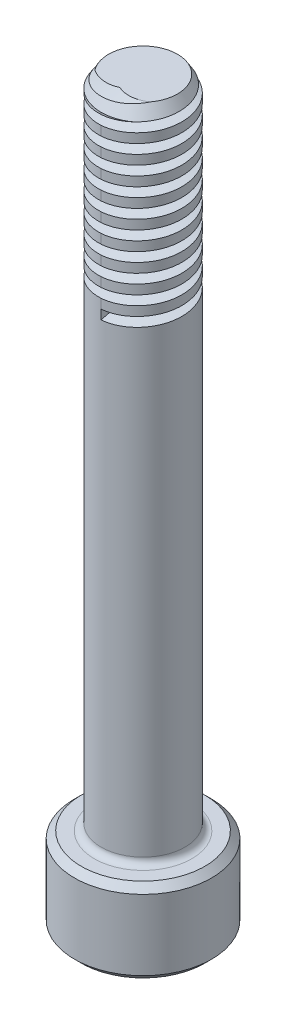
from build123d import *

# Parameters (mm, degrees)
CUT_SWEEP1_PITCH   = 0.635
CUT_EXTRUDE1_DEPTH = 1.2954
FILLET1_R          = 0.2286
FILLET2_R          = 0.396875794
CHAMFER2_SIZE      = 0.2286
CHAMFER3_SIZE      = 0.127


with BuildPart() as part:
    # Sketch1 → Revolve1 (revolve)
    with BuildSketch(Plane.XY, mode=Mode.PRIVATE) as revolve1_sk:
        Polygon((0, 0), (0, 25.0698), (1.4224, 25.0698), (1.4224, 2.8448), (2.3241, 2.8448), (2.3241, 0), align=None)
    revolve(revolve1_sk.sketch.rotate(Axis((0, 0, 0), (0, 1, 0)), 90), axis=Axis((0, 0, 0), (0, 1, 0)))

    # Cut-Sweep1: arcs per turn and ends read off the stored shape
    # Cut-Sweep1: the profile of Sketch3 profile screwed along a right-hand helix through 11 turns, 6 arcs to a turn; built about Z, then put on its axis
    cut_sweep1_z = Axis((0, 0, 0), (0, 0, 1))
    cut_sweep1_corners = [(1.4227, 0, -0.476175), (1.4227, 0, -0.793825), (0.78739873, 0, -0.635)]
    with BuildLine(mode=Mode.PRIVATE) as cut_sweep1_profile:
        Line(cut_sweep1_corners[0], cut_sweep1_corners[1])
        Line(cut_sweep1_corners[1], cut_sweep1_corners[2])
        Line(cut_sweep1_corners[2], cut_sweep1_corners[0])
    cut_sweep1_cap = Face(cut_sweep1_profile.wire())
    cut_sweep1_turn_angles = [0, 30, 60, 90, 120, 150, 180, 210, 240, 270, 300, 330, 360]
    cut_sweep1_turn_weights = [1, 0.8660254037844387, 1, 0.8660254037844387, 1, 0.8660254037844387, 1, 0.8660254037844387, 1, 0.8660254037844387, 1, 0.8660254037844387, 1]
    cut_sweep1_turn_rails = [Edge.make_bspline([Vector(p[0], p[1], 0).rotate(cut_sweep1_z, cut_sweep1_turn_angles[k]) / cut_sweep1_turn_weights[k] + Vector(0, 0, p[2] + CUT_SWEEP1_PITCH * cut_sweep1_turn_angles[k] / 360) for k in range(13)], [0, 0, 0, 1, 1, 2, 2, 3, 3, 4, 4, 5, 5, 6, 6, 6], 2, cut_sweep1_turn_weights) for p in cut_sweep1_corners]
    cut_sweep1_turn_sides = [Face.make_surface_from_curves(cut_sweep1_turn_rails[p[0]], cut_sweep1_turn_rails[p[1]]) for p in [(0, 1), (1, 2), (2, 0)]]
    cut_sweep1 = Plane(origin=(0, 25.0698, 0), x_dir=(0, 0, 1), z_dir=(0, -1, 0)) * Solid(Shell([*[p.moved(Location((0, 0, CUT_SWEEP1_PITCH * i))) for i in range(11) for p in cut_sweep1_turn_sides], cut_sweep1_cap, cut_sweep1_cap.rotate(cut_sweep1_z, 3960).moved(Location((0, 0, CUT_SWEEP1_PITCH * 3960 / 360)))]))
    add(cut_sweep1, mode=Mode.SUBTRACT)

    # Sketch4 → Cut-Extrude1 (cut)
    with BuildSketch(Plane(origin=(0, 0, 0), x_dir=(1, 0, 0), z_dir=(0, 1, 0))):
        Polygon((0, 1.378481503), (-1.1938, 0.689240751), (-1.1938, -0.689240751), (0, -1.378481503), (1.1938, -0.689240751), (1.1938, 0.689240751), align=None)
    extrude(amount=CUT_EXTRUDE1_DEPTH, mode=Mode.SUBTRACT)

    # Fillet1
    fillet1_edges = [part.edges().sort_by_distance(p)[0] for p in [
        (0, 2.8448, 1.4224),
    ]]
    fillet(fillet1_edges, radius=FILLET1_R)

    # Fillet2
    fillet2_edges = [part.edges().sort_by_distance(p)[0] for p in [
        (1.1938, 0.6477, -0.689240751),
        (0, 0.6477, -1.378481503),
        (-1.1938, 0.6477, -0.689240751),
        (-1.1938, 0.6477, 0.689240751),
        (0, 0.6477, 1.378481503),
        (1.1938, 0.6477, 0.689240751),
        (0.5969, 1.2954, -1.033861127),
        (-0.5969, 1.2954, -1.033861127),
        (-1.1938, 1.2954, 0),
        (-0.5969, 1.2954, 1.033861127),
        (0.5969, 1.2954, 1.033861127),
        (1.1938, 1.2954, 0),
    ]]
    fillet(fillet2_edges, radius=FILLET2_R)

    # Chamfer1: read off the stored shape, not the designer's step
    # Chamfer1 outline → Chamfer1 (revolve, cut)
    with BuildSketch(Plane.XY):
        Polygon((1.4224, 25.0698), (1.168399492, 25.0698), (1.4224, 24.658376279), align=None)
    revolve(axis=Axis((0, 0, 0), (0, 1, 0)), mode=Mode.SUBTRACT)

    # Chamfer2
    chamfer2_edges = [part.edges().sort_by_distance(p)[0] for p in [
        (0, 0, 2.3241),
        (0, 2.8448, 2.3241),
    ]]
    chamfer(chamfer2_edges, length=CHAMFER2_SIZE)

    # Chamfer3
    chamfer3_edges = [part.edges().sort_by_distance(p)[0] for p in [
        (0.5969, 0, -1.033861127),
        (-0.5969, 0, -1.033861127),
        (-1.1938, 0, 0),
        (-0.5969, 0, 1.033861127),
        (0.5969, 0, 1.033861127),
        (1.1938, 0, 0),
        (0, 0, -1.317084604),
        (1.140628726, 0, -0.658542302),
        (1.140628726, 0, 0.658542302),
        (0, 0, 1.317084604),
        (-1.140628726, 0, 0.658542302),
        (-1.140628726, 0, -0.658542302),
    ]]
    chamfer(chamfer3_edges, length=CHAMFER3_SIZE)


solid = part.part
